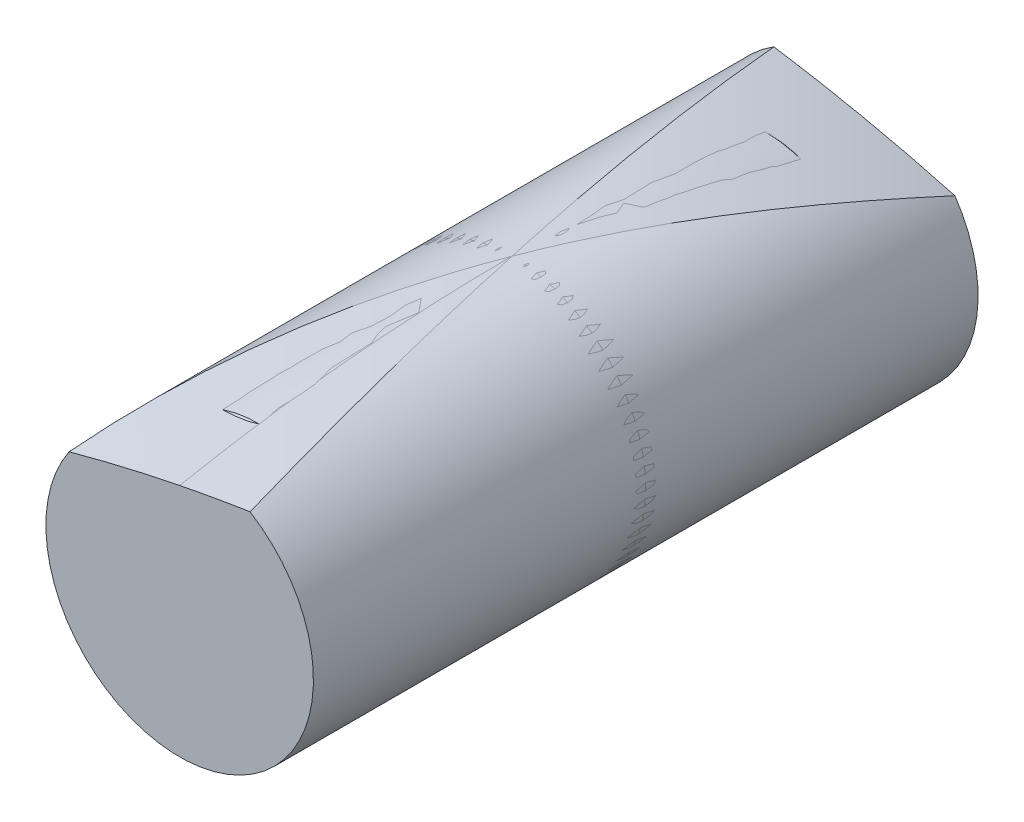
from build123d import *
from OCP.BRepAlgoAPI import BRepAlgoAPI_Cut
from OCP.TopTools import TopTools_ListOfShape

# Parameters (mm, degrees)
EXTRUDE_1_DEPTH      = 45.961941
EXTRUDE_1_DEPTH_BACK = 45.961941
SKETCH_1_R           = 18.5
CUT_EXTRUDE_START    = -55.581475552
CUT_EXTRUDE_1_DEPTH  = 91.162951004


with BuildPart() as part:
    # Эскиз1 → Бобышка-Вытянуть1 (new, two sides: drawn at the far end of the back side and taken through both)
    with BuildSketch(Plane.XY.offset(-EXTRUDE_1_DEPTH_BACK)):
        Circle(SKETCH_1_R)
    extrude(amount=EXTRUDE_1_DEPTH + EXTRUDE_1_DEPTH_BACK)


with BuildPart() as cut_extrude_1_tool:
    # Вырез-Вытянуть1: read off the stored shape, not the designer's step
    # Вырез-Вытянуть1 outline → Вырез-Вытянуть1 (new body)
    with BuildSketch(Plane(origin=(7.071067812, -101.5, 7.071067812), x_dir=(0.7071067811865488, 0, -0.7071067811865464), z_dir=(0.7071067811865464, 0, 0.7071067811865488)).offset(CUT_EXTRUDE_START)):
        with BuildLine():
            ThreePointArc((0, 120), (22.031377282, 117.960240823), (43.313776165, 111.910306917))
            Line((43.313776165, 111.910306917), (45, 111.257670679))
            Line((45, 111.257670679), (45, 122))
            Line((45, 122), (-45, 122))
            Line((-45, 122), (-45, 111.257670679))
            Line((-45, 111.257670679), (-43.313776165, 111.910306917))
            ThreePointArc((-43.313776165, 111.910306917), (-22.031377282, 117.960240823), (0, 120))
        make_face()
    extrude(amount=CUT_EXTRUDE_1_DEPTH)


with BuildPart() as part_1:
    add(part.part)

    # Вырез-Вытянуть1: cut by cut_extrude_1_tool, with a tolerance
    cut_extrude_1_stock = TopTools_ListOfShape()
    cut_extrude_1_stock.Append(part_1.part.wrapped)
    cut_extrude_1_tools = TopTools_ListOfShape()
    cut_extrude_1_tools.Append(cut_extrude_1_tool.part.wrapped)
    cut_extrude_1_cut = BRepAlgoAPI_Cut()
    cut_extrude_1_cut.SetArguments(cut_extrude_1_stock)
    cut_extrude_1_cut.SetTools(cut_extrude_1_tools)
    cut_extrude_1_cut.SetFuzzyValue(0.00001)
    cut_extrude_1_cut.Build()
    add(Compound.cast(cut_extrude_1_cut.Shape()).solids(), mode=Mode.REPLACE)


with BuildPart() as body_2:
    # Эскиз5 → Повернуть1 (revolve)
    with BuildSketch(Plane(origin=(0, 0, 0), x_dir=(0, 0, -1), z_dir=(1, 0, 0))):
        with BuildLine():
            Line((-45.961940777, 14.015150521), (-45.961940777, 0))
            Line((-45.961940777, 0), (0, 0))
            Line((0, 0), (0, 18.5))
            add(Edge.make_bspline(
                [(0, 18.5), (-23.418590613, 18.5), (-45.961940777, 14.015150521)],
                knots=[4.71238898, 4.71238898, 4.71238898, 4.986647594, 4.986647594, 4.986647594], degree=2, weights=[1, 0.990612501, 1]))
        make_face()
    revolve(axis=Axis((0, 0, 1045.961940777), (0, 0, -1)))

    # Эскиз6 → Вырез-Повернуть1 (revolve, cut)
    with BuildSketch(Plane(origin=(0, 0, 0), x_dir=(1, 0, 0), z_dir=(0, 1, 0)), mode=Mode.PRIVATE) as cut_revolve_1_sk:
        with BuildLine():
            Line((4.949747468, -45.961940777), (15.921673633, -34.990014613))
            add(Edge.make_bspline(
                [(14.015150521, -45.961940777), (15.097613594, -40.520878777), (15.921673633, -34.990014613)],
                knots=[1.296537713, 1.296537713, 1.296537713, 1.36312621, 1.36312621, 1.36312621], degree=2, weights=[1, 0.999445798, 1]))
            Line((14.015150521, -45.961940777), (4.949747468, -45.961940777))
        make_face()
    revolve(cut_revolve_1_sk.sketch.rotate(Axis((0, 0, 1000), (0, 0, -1)), 180), axis=Axis((0, 0, 1000), (0, 0, -1)), mode=Mode.SUBTRACT)


with BuildPart() as body_3:
    # Зеркальное отражение1: mirrored copy
    add(body_2.part.mirror(Plane(origin=(0, 18.5, 0), x_dir=(1, 0, 0), z_dir=(0, 0, 1))))


solid = Compound([part_1.part, body_2.part, body_3.part])
